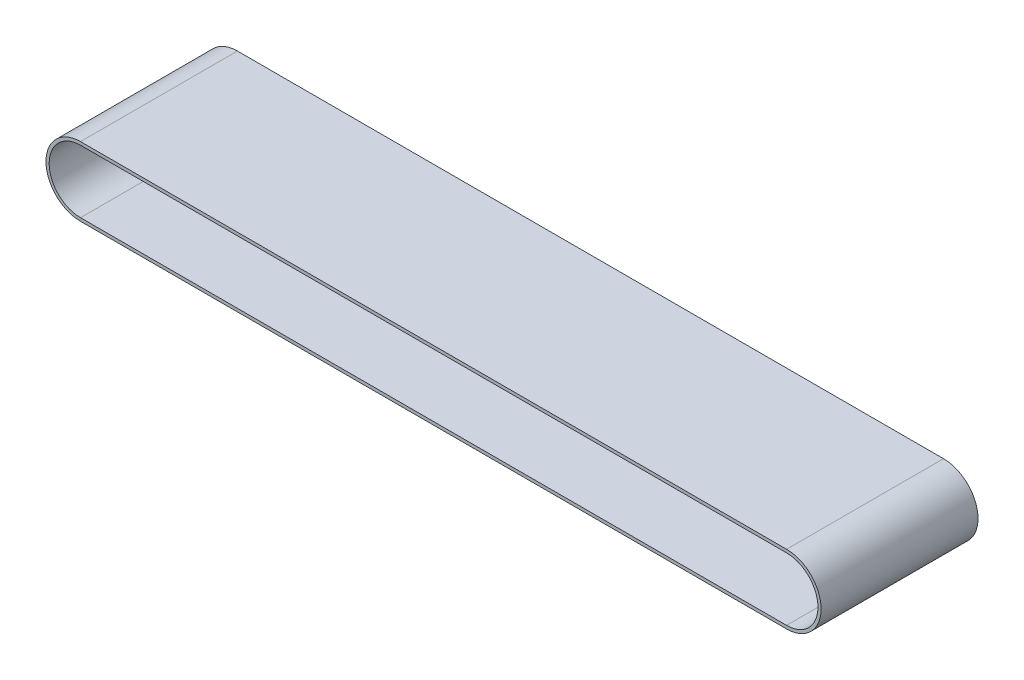
from build123d import *

# Parameters (mm, degrees)
BOSS_EXTRUDE1_DEPTH = 100
SHELL2_T            = -2


with BuildPart() as part:
    # Sketch1 → Boss-Extrude1 (new body)
    with BuildSketch(Plane.XY):
        with BuildLine():
            Line((-371.346770179, 20), (78.653229821, 20))
            ThreePointArc((78.653229821, 20), (100.653229821, -2), (78.653229821, -24))
            Line((78.653229821, -24), (-371.346770179, -24))
            ThreePointArc((-371.346770179, -24), (-393.346770179, -2), (-371.346770179, 20))
        make_face()
    extrude(amount=BOSS_EXTRUDE1_DEPTH)

    # Shell2
    shell2_openings = [part.faces().sort_by_distance(p)[0] for p in [
        (-146.346770179, -2, 0),
        (-146.346770179, -2, 100),
    ]]
    offset(amount=SHELL2_T, openings=shell2_openings, kind=Kind.INTERSECTION)


solid = part.part
